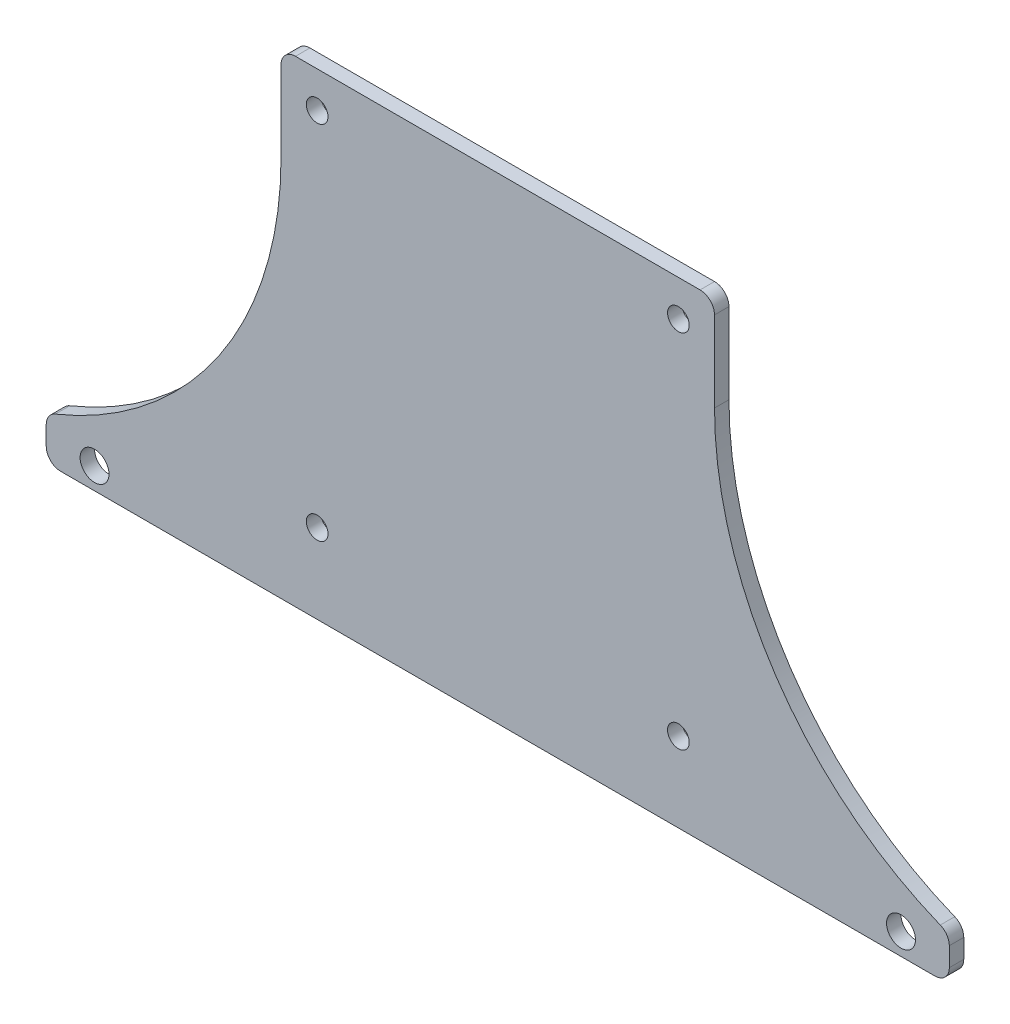
from build123d import *

# Parameters (mm, degrees)
SKETCH_1_W      = 60
SKETCH_1_H      = 60
SKETCH_1_R      = 1.5
EXTRUDE_1_DEPTH = 2
SKETCH_2_W      = 125
SKETCH_2_H      = 6
SKETCH_2_R      = 2
EXTRUDE_2_DEPTH = 2
FILLET_1_R      = 50
FILLET_2_R      = 2


with BuildPart() as part:
    # 草图1 → 凸台-拉伸1 (new body)
    with BuildSketch(Plane.XY):
        with Locations((30, 30)):
            Rectangle(SKETCH_1_W, SKETCH_1_H)
        with Locations((5, 55)):
            Circle(SKETCH_1_R, mode=Mode.SUBTRACT)
        with Locations(Location((55, 55, 0), (0, 0, 180))):
            Circle(SKETCH_1_R, mode=Mode.SUBTRACT)
        with Locations((55, 5)):
            Circle(SKETCH_1_R, mode=Mode.SUBTRACT)
        with Locations(Location((5, 5, 0), (0, 0, 180))):
            Circle(SKETCH_1_R, mode=Mode.SUBTRACT)
    extrude(amount=EXTRUDE_1_DEPTH)

    # 草图2 → 凸台-拉伸2 (add)
    with BuildSketch(Plane.XY.offset(2)):
        with Locations((30, -3)):
            Rectangle(SKETCH_2_W, SKETCH_2_H)
        with Locations((-25.815, -3)):
            Circle(SKETCH_2_R, mode=Mode.SUBTRACT)
        with Locations(Location((85.815, -3, 0), (0, 0, 180))):
            Circle(SKETCH_2_R, mode=Mode.SUBTRACT)
    extrude(amount=-EXTRUDE_2_DEPTH)

    # 圆角1
    # the kernel refuses this fillet: 50 mm, written as the material it adds along each edge
    with BuildSketch(Plane(origin=(60, 0, 0), x_dir=(1, 0, 0), z_dir=(0, 0, 1))) as fillet_1_piece_1:
        with BuildLine():
            CenterArc((50, 46.837484988), FILLET_1_R, 180, 69.512684885)
            Line((0, 46.837484988), (-1, 46.837484988))
            Line((-1, 46.837484988), (-1, 0))
            Line((-1, 0), (0, -1))
            ThreePointArc((0, -1), (16.25, -1), (32.15, -0.9367497))
            Line((32.15, -0.9367497), (32.5, 0))
        make_face()
    extrude(amount=2)
    with BuildSketch(Plane(origin=(0, 0, 0), x_dir=(-1, 0, 0), z_dir=(0, 0, 1))) as fillet_1_piece_2:
        with BuildLine():
            CenterArc((50, -46.837484988), FILLET_1_R, 110.487315115, 69.512684885)
            Line((0, -46.837484988), (-1, -46.837484988))
            Line((-1, -46.837484988), (-1, 0))
            Line((-1, 0), (0, 1))
            ThreePointArc((0, 1), (16.25, 1), (32.15, 0.9367497))
            Line((32.15, 0.9367497), (32.5, 0))
        make_face()
    extrude(amount=2)

    # 圆角2
    fillet_2_edges = [part.edges().sort_by_distance(p)[0] for p in [
        (-32.5, -6, 1),
        (-32.5, 0, 1),
        (92.5, 0, 1),
        (92.5, -6, 1),
        (0, 60, 1),
        (60, 60, 1),
    ]]
    fillet(fillet_2_edges, radius=FILLET_2_R)


solid = part.part
